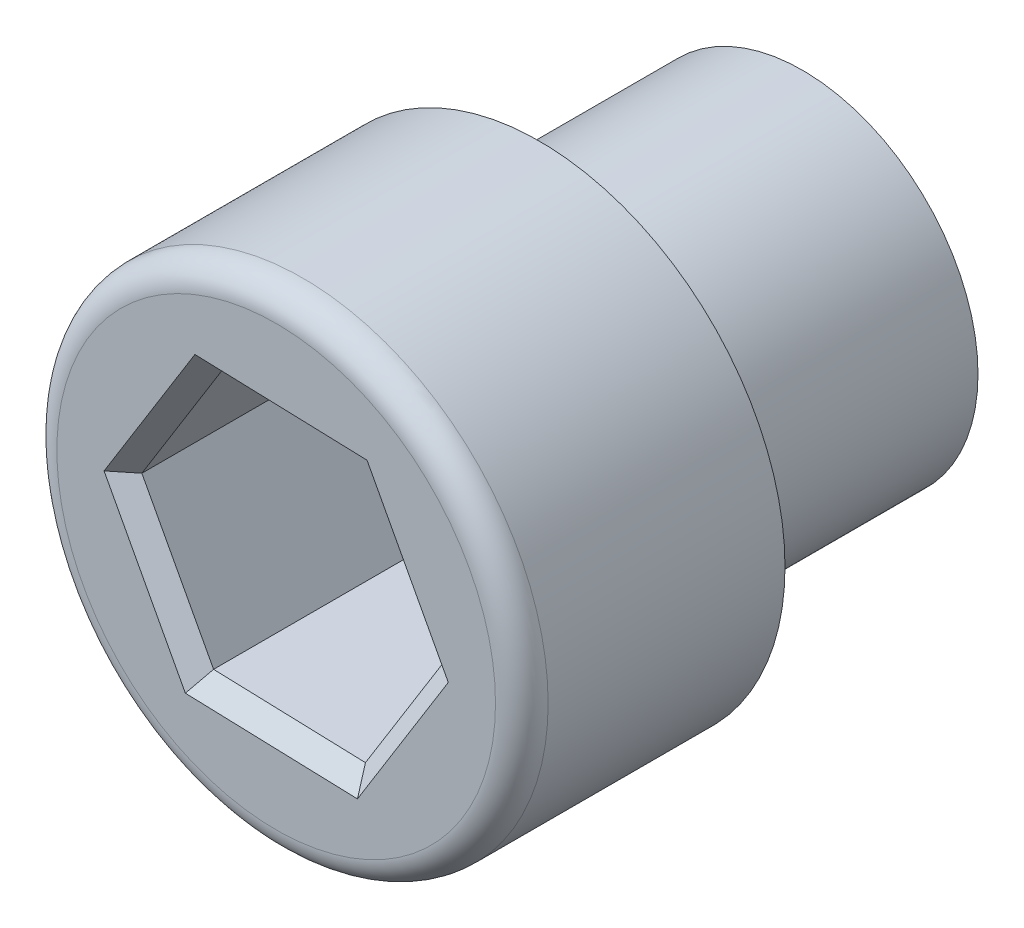
from build123d import *

# Parameters (mm, degrees)
SZKIC1_R                    = 2
DODANIE_WYCI_GNI_CIE1_DEPTH = 3
SZKIC2_R                    = 2.8
DODANIE_WYCI_GNI_CIE2_DEPTH = 3
ZAOKR_GLENIE1_R             = 0.3
WYTNIJ_WYCI_GNI_CIE1_DEPTH  = 3
SFAZOWANIE1_SIZE            = 0.2


with BuildPart() as part:
    # Szkic1 → Dodanie-wyciągnięcie1 (new body)
    with BuildSketch(Plane.XY):
        Circle(SZKIC1_R)
    extrude(amount=DODANIE_WYCI_GNI_CIE1_DEPTH)

    # Szkic2 → Dodanie-wyciągnięcie2 (add)
    with BuildSketch(Plane.XY.offset(3)):
        Circle(SZKIC2_R)
    extrude(amount=DODANIE_WYCI_GNI_CIE2_DEPTH)

    # Zaokrąglenie1
    zaokr_glenie1_edges = [part.edges().sort_by_distance(p)[0] for p in [
        (-2.8, 0, 6),
    ]]
    fillet(zaokr_glenie1_edges, radius=ZAOKR_GLENIE1_R)

    # Szkic3 → Wytnij-wyciągnięcie1 (cut)
    with BuildSketch(Plane.XY.offset(6)):
        Polygon((-0.817437581, 1.527021873), (-1.731158525, 0.055589226), (-0.913720944, -1.471432648), (0.817437581, -1.527021873), (1.731158525, -0.055589226), (0.913720944, 1.471432648), align=None)
    extrude(amount=-WYTNIJ_WYCI_GNI_CIE1_DEPTH, mode=Mode.SUBTRACT)

    # Sfazowanie1
    sfazowanie1_edges = [part.edges().sort_by_distance(p)[0] for p in [
        (-0.048141682, -1.49922726, 6),
        (-1.322439734, -0.707921711, 6),
        (-1.274298053, 0.79130555, 6),
        (0.048141682, 1.49922726, 6),
        (1.322439734, 0.707921711, 6),
        (1.274298053, -0.79130555, 6),
    ]]
    chamfer(sfazowanie1_edges, length=SFAZOWANIE1_SIZE)


solid = part.part
